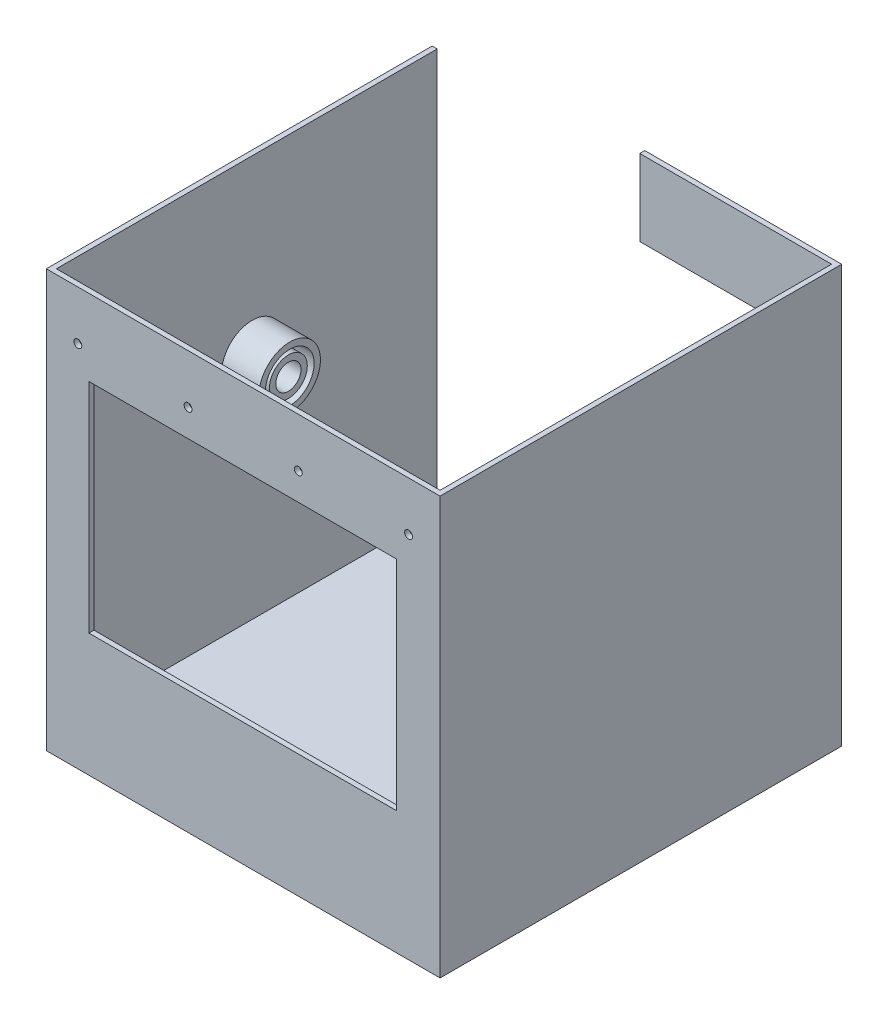
from build123d import *

# Parameters (mm, degrees)
SKETCH1_W               = 250
SKETCH1_H               = 255
BOSS_EXTRUDE1_DEPTH     = 10
SKETCH2_W               = 250
SKETCH2_H               = 255
SKETCH2_W_2             = 243.6
SKETCH2_H_2             = 248.6
BOSS_EXTRUDE2_DEPTH     = 255
SKETCH7_R               = 12
SKETCH7_R_2             = 8
BOSS_EXTRUDE3_DEPTH     = 23
SKETCH10_R              = 19.5
SKETCH10_R_2            = 15.5
BOSS_EXTRUDE4_DEPTH     = 31
BOSS_EXTRUDE5_START     = 31
SKETCH11_R              = 19.5
SKETCH11_R_2            = 15.5
BOSS_EXTRUDE5_DEPTH     = 31
BOSS_EXTRUDE6_START     = 23
SKETCH12_R              = 12
SKETCH12_R_2            = 8
BOSS_EXTRUDE6_DEPTH     = 23
SKETCH14_R              = 2.5
CUT_EXTRUDE3_DEPTH      = 23
CUT_EXTRUDE4_DEPTH      = 445.690903887
CUT_EXTRUDE4_DEPTH_BACK = 445.690903887
SKETCH16_W              = 195.424536328
SKETCH16_H              = 138.384379786
CUT_EXTRUDE5_DEPTH      = 445.690903887
CUT_EXTRUDE5_DEPTH_BACK = 10


with BuildPart() as part:
    # Sketch1 → Boss-Extrude1 (new body)
    with BuildSketch(Plane(origin=(0, 0, 0), x_dir=(1, 0, 0), z_dir=(0, 1, 0))):
        with Locations((125, 127.5)):
            Rectangle(SKETCH1_W, SKETCH1_H)
    extrude(amount=BOSS_EXTRUDE1_DEPTH)

    # Sketch2 → Boss-Extrude2 (add)
    with BuildSketch(Plane(origin=(0, 10, 0), x_dir=(1, 0, 0), z_dir=(0, 1, 0))):
        with Locations((125, 127.5)):
            Rectangle(SKETCH2_W, SKETCH2_H)
        with Locations((125, 127.5)):
            Rectangle(SKETCH2_W_2, SKETCH2_H_2, mode=Mode.SUBTRACT)
    extrude(amount=BOSS_EXTRUDE2_DEPTH)

    # Sketch7 → Boss-Extrude3 (add)
    with BuildSketch(Plane.ZY.offset(-246.8)):
        with Locations((-127.5, 155)):
            Circle(SKETCH7_R)
        with Locations((-127.5, 155)):
            Circle(SKETCH7_R_2, mode=Mode.SUBTRACT)
    extrude(amount=BOSS_EXTRUDE3_DEPTH)

    # Sketch10 → Boss-Extrude4 (add)
    with BuildSketch(Plane.ZY.offset(-246.8)):
        with Locations((-127.5, 155)):
            Circle(SKETCH10_R)
        with Locations((-127.5, 155)):
            Circle(SKETCH10_R_2, mode=Mode.SUBTRACT)
    extrude(amount=BOSS_EXTRUDE4_DEPTH)

    # Sketch11 → Boss-Extrude5 (add)
    with BuildSketch(Plane(origin=(3.2, 0, 0), x_dir=(0, 0, -1), z_dir=(1, 0, 0)).offset(BOSS_EXTRUDE5_START)):
        with Locations((127.5, 155)):
            Circle(SKETCH11_R)
        with Locations((127.5, 155)):
            Circle(SKETCH11_R_2, mode=Mode.SUBTRACT)
    extrude(amount=-BOSS_EXTRUDE5_DEPTH)

    # Sketch12 → Boss-Extrude6 (add)
    with BuildSketch(Plane(origin=(3.2, 0, 0), x_dir=(0, 0, -1), z_dir=(1, 0, 0)).offset(BOSS_EXTRUDE6_START)):
        with Locations((127.5, 155)):
            Circle(SKETCH12_R)
        with Locations((127.5, 155)):
            Circle(SKETCH12_R_2, mode=Mode.SUBTRACT)
    extrude(amount=-BOSS_EXTRUDE6_DEPTH)

    # Sketch14 → Cut-Extrude3 (cut)
    with BuildSketch(Plane.XY):
        with Locations((160, 233.833333333)):
            Circle(SKETCH14_R)
        with Locations((90, 233.833333333)):
            Circle(SKETCH14_R)
        with Locations((20, 233.833333333)):
            Circle(SKETCH14_R)
        with Locations((230, 233.833333333)):
            Circle(SKETCH14_R)
    extrude(amount=-CUT_EXTRUDE3_DEPTH, mode=Mode.SUBTRACT)

    # Sketch16 → Cut-Extrude4 (cut, two sides: drawn at the far end of the back side and taken through both)
    with BuildSketch(Plane.XY.offset(-CUT_EXTRUDE4_DEPTH_BACK)):
        with Locations((124.751999319, 147.380040837)):
            Rectangle(SKETCH16_W, SKETCH16_H)
    extrude(amount=CUT_EXTRUDE4_DEPTH + CUT_EXTRUDE4_DEPTH_BACK, mode=Mode.SUBTRACT)

    # Sketch19 → Cut-Extrude5 (cut, two sides: drawn at the far end of the back side and taken through both)
    with BuildSketch(Plane(origin=(0, 0, -255), x_dir=(-1, 0, 0), z_dir=(0, 0, -1)).offset(-CUT_EXTRUDE5_DEPTH_BACK)):
        Polygon((-125, 861.003412959), (-125, 265), (-125, 0), (-125, -596.003412959), (1067.006825919, -596.003412959), (1067.006825919, 861.003412959), align=None)
    extrude(amount=CUT_EXTRUDE5_DEPTH + CUT_EXTRUDE5_DEPTH_BACK, mode=Mode.SUBTRACT)


solid = part.part
